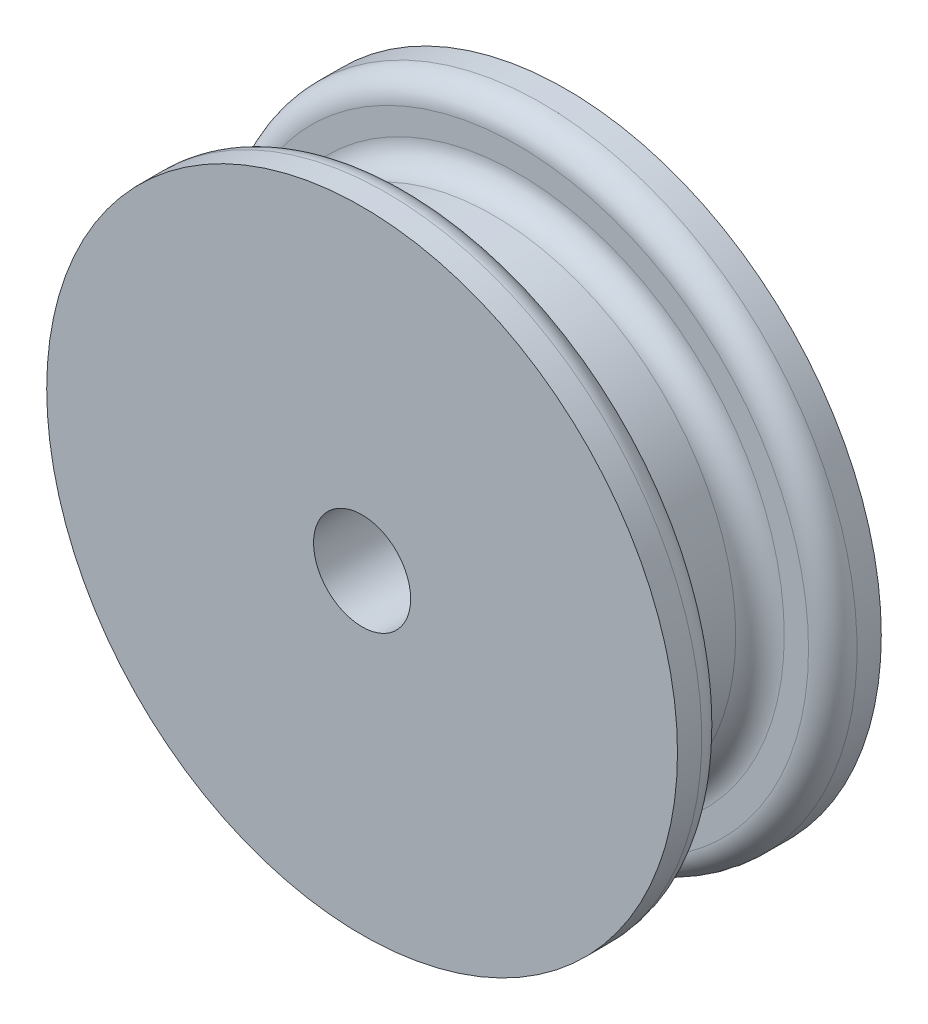
from build123d import *

# Parameters (mm, degrees)
SKETCH1_R           = 6.5
SKETCH1_R_2         = 1
BOSS_EXTRUDE1_DEPTH = 4.2


with BuildPart() as part:
    # Sketch1 → Boss-Extrude1 (new body)
    with BuildSketch(Plane.XY):
        Circle(SKETCH1_R)
        Circle(SKETCH1_R_2, mode=Mode.SUBTRACT)
    extrude(amount=BOSS_EXTRUDE1_DEPTH)

    # Sketch2 → Cut-Revolve1 (revolve, cut)
    with BuildSketch(Plane(origin=(0, 0, 0), x_dir=(0, 0, -1), z_dir=(1, 0, 0))):
        with BuildLine():
            Line((-4.2, 6.5), (-3.7, 6.5))
            ThreePointArc((-3.7, 6.5), (-3.346446609, 6.353553391), (-3.2, 6))
            Line((-3.2, 6), (-3.2, 5.5))
            ThreePointArc((-3.2, 5.5), (-3.053553391, 5.146446609), (-2.7, 5))
            Line((-2.7, 5), (-1.5, 5))
            ThreePointArc((-1.5, 5), (-1.146446609, 5.146446609), (-1, 5.5))
            Line((-1, 5.5), (-1, 6))
            ThreePointArc((-1, 6), (-0.853553391, 6.353553391), (-0.5, 6.5))
            Line((-0.5, 6.5), (0, 6.5))
            Line((0, 6.5), (0, 7.64198068))
            Line((0, 7.64198068), (-4.2, 7.64198068))
            Line((-4.2, 7.64198068), (-4.2, 6.5))
        make_face()
    revolve(axis=Axis((0, 0, 0), (0, 0, 1)), mode=Mode.SUBTRACT)


solid = part.part
